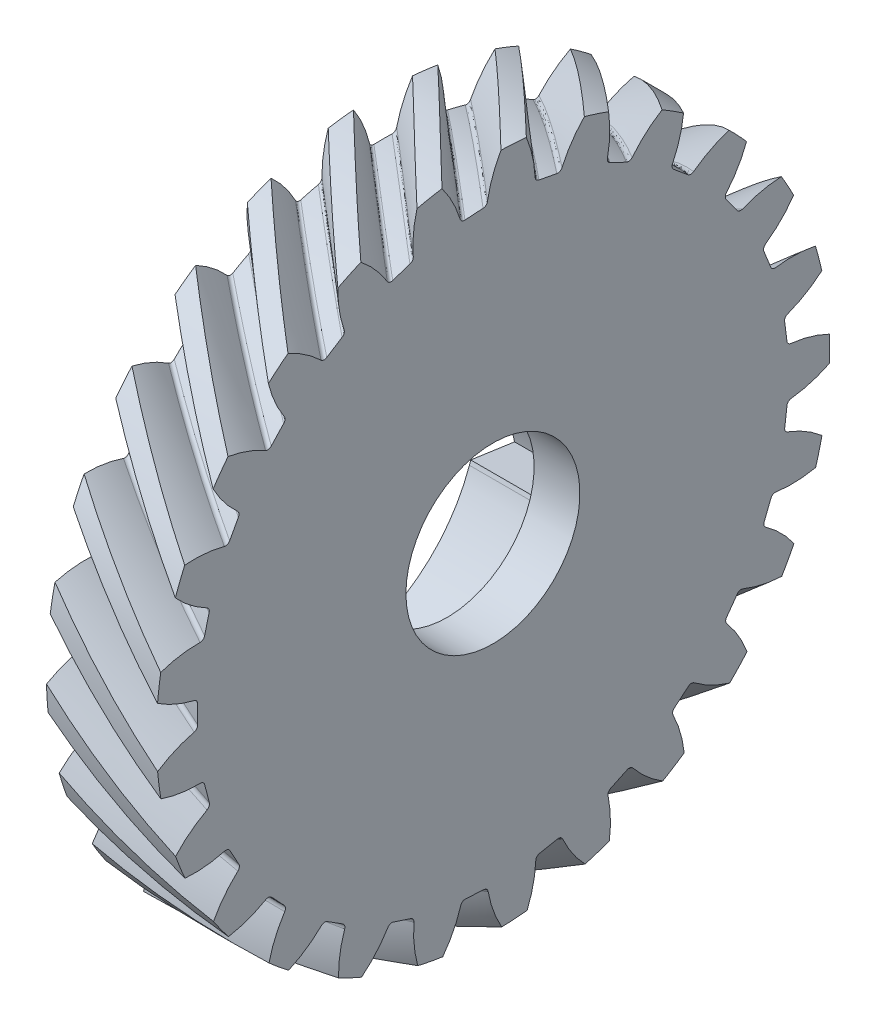
from build123d import *

# Parameters (mm, degrees)
BASPROSKE_W            = 12
BASPROSKE_H            = 36.754089775
TOOTHCUTRH_PITCH       = 239.137870171
TOOTHCUTRH_HEIGHT      = 12
TOOTHCUTRH_RADIUS      = 36.754089775
TOOTHCUTRH_START_ANGLE = -90
TEETHCUTSRH_COUNT      = 25
TEETHCUTSRH_ANGLE      = 345.6
BORSKE_R               = 9.5
BORE_DEPTH             = 62.5000025
CUT_EXTRUDE1_DEPTH     = 7


with BuildPart() as part:
    # BasProSke → Base-Revolve (revolve)
    with BuildSketch(Plane(origin=(0, 0, 0), x_dir=(1, 0, 0), z_dir=(0, 1, 0)), mode=Mode.PRIVATE) as base_revolve_sk:
        with Locations((6, 18.377044888)):
            Rectangle(BASPROSKE_W, BASPROSKE_H)
    revolve(base_revolve_sk.sketch.rotate(Axis((-10, 0, 0), (1, 0, 0)), 180), axis=Axis((-10, 0, 0), (1, 0, 0)))

    # ToothCutRH: sweep along a helix
    with BuildLine() as toothcutrh_path:
        add(Helix(TOOTHCUTRH_PITCH, TOOTHCUTRH_HEIGHT, TOOTHCUTRH_RADIUS, center=(0, 0, 0), direction=(1, 0, 0), mode=Mode.PRIVATE).rotate(Axis((0, 0, 0), (1, 0, 0)), TOOTHCUTRH_START_ANGLE))
    # TooCutSkeRH → ToothCutRH (sweep, cut)
    with BuildSketch(Plane(origin=(0, 0, 0), x_dir=(0, 0, -1), z_dir=(1, 0, 0))):
        with BuildLine():
            ThreePointArc((0.991141532, 32.238857699), (0, 32.254089775), (-0.991141532, 32.238857699))
            ThreePointArc((-0.991141532, 32.238857699), (-1.310848692, 32.341632028), (-1.493827956, 32.623223611))
            ThreePointArc((-1.493827956, 32.623223611), (-2.455033444, 35.27631052), (-3.986846137, 37.646191531))
            ThreePointArc((-3.986846137, 37.646191531), (0, 37.856712469), (3.986846137, 37.646191531))
            ThreePointArc((3.986846137, 37.646191531), (2.455033444, 35.27631052), (1.493827956, 32.623223611))
            ThreePointArc((1.493827956, 32.623223611), (1.310848692, 32.341632028), (0.991141532, 32.238857699))
        make_face()
    toothcutrh = sweep(path=toothcutrh_path.line, is_frenet=True, mode=Mode.SUBTRACT)

    # TeethCutsRH: ToothCutRH ×25 about axis
    teethcutsrh_axis = Axis((-10, 0, 0), (1, 0, 0))
    for i in range(1, TEETHCUTSRH_COUNT):
        add(toothcutrh.rotate(teethcutsrh_axis, i * TEETHCUTSRH_ANGLE / (TEETHCUTSRH_COUNT - 1)), mode=Mode.SUBTRACT)

    # BorSke → Bore (cut, symmetric)
    with BuildSketch(Plane(origin=(0, 0, 0), x_dir=(0, 0, -1), z_dir=(1, 0, 0))):
        with Locations(Location((0, 0, 0), (0, 0, 180))):
            Circle(BORSKE_R)
    extrude(amount=BORE_DEPTH, both=True, mode=Mode.SUBTRACT)

    # Sketch3 → Cut-Extrude1 (cut)
    with BuildSketch(Plane.ZY):
        with BuildLine():
            Line((3.573977183, -14.365752134), (2.887319589, -9.574099727))
            ThreePointArc((2.887319589, -9.574099727), (3.105055978, -9.505715511), (3.321175082, -9.432380191))
            ThreePointArc((3.321175082, -9.432380191), (10.602163403, -4.422632358), (14.365752134, 3.573977183))
            Line((14.365752134, 3.573977183), (9.574099727, 2.887319589))
            ThreePointArc((9.574099727, 2.887319589), (9.505715511, 3.105055978), (9.432380191, 3.321175082))
            ThreePointArc((9.432380191, 3.321175082), (4.422632358, 10.602163403), (-3.573977183, 14.365752134))
            Line((-3.573977183, 14.365752134), (-2.887319589, 9.574099727))
            ThreePointArc((-2.887319589, 9.574099727), (-3.105055978, 9.505715511), (-3.321175082, 9.432380191))
            ThreePointArc((-3.321175082, 9.432380191), (-10.602163403, 4.422632358), (-14.365752134, -3.573977183))
            Line((-14.365752134, -3.573977183), (-9.574099727, -2.887319589))
            ThreePointArc((-9.574099727, -2.887319589), (-9.505715511, -3.105055978), (-9.432380191, -3.321175082))
            ThreePointArc((-9.432380191, -3.321175082), (-4.422632358, -10.602163403), (3.573977183, -14.365752134))
        make_face()
    extrude(amount=-CUT_EXTRUDE1_DEPTH, mode=Mode.SUBTRACT)


solid = part.part
